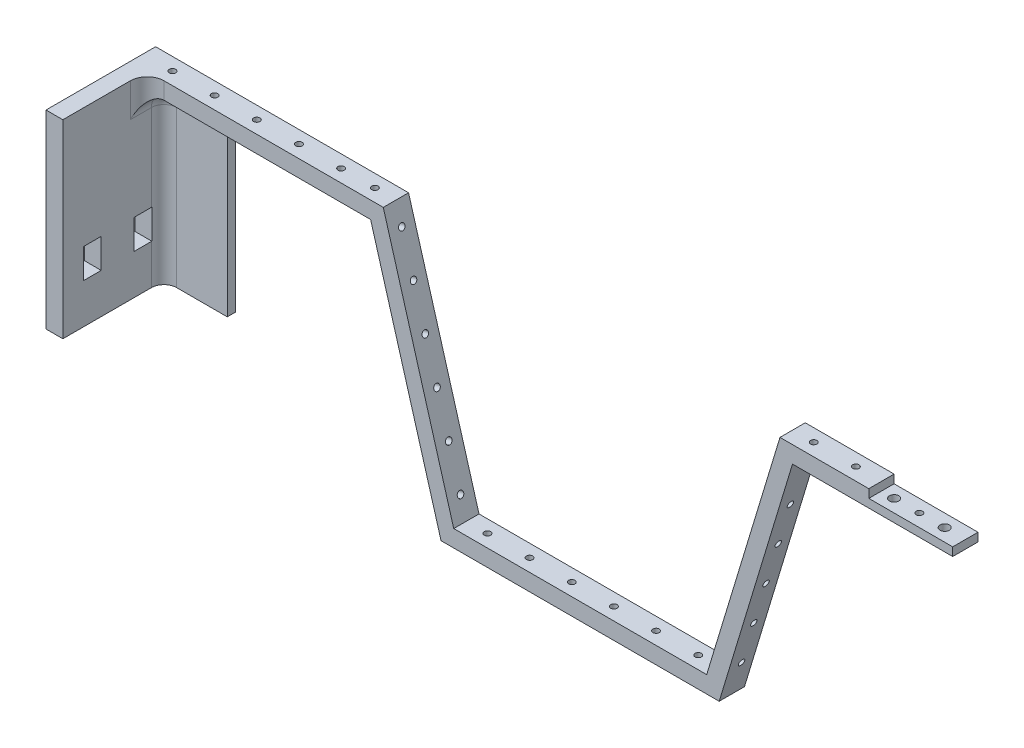
from build123d import *

# Parameters (mm, degrees)
BOSS_EXTRUDE1_DEPTH = 6
SKETCH2_R           = 1.1
CUT_EXTRUDE1_DEPTH  = 6
SKETCH3_R           = 0.75
CUT_EXTRUDE2_DEPTH  = 6
SKETCH4_R           = 0.75
CUT_EXTRUDE3_DEPTH  = 6
SKETCH5_R           = 0.75
CUT_EXTRUDE4_DEPTH  = 6
SKETCH6_R           = 0.75
CUT_EXTRUDE5_DEPTH  = 6
SKETCH7_R           = 0.75
CUT_EXTRUDE6_DEPTH  = 6
SKETCH8_R           = 0.75
CUT_EXTRUDE7_DEPTH  = 6
SKETCH9_R           = 0.75
CUT_EXTRUDE8_DEPTH  = 6
SKETCH12_W          = 20
SKETCH12_H          = 45
BOSS_EXTRUDE5_DEPTH = 4
FILLET4_R           = 4
SKETCH13_W          = 19
SKETCH13_H          = 45
BOSS_EXTRUDE6_DEPTH = 2
FILLET5_R           = 3
SKETCH14_W          = 4.2
SKETCH14_H          = 7
CUT_EXTRUDE10_DEPTH = 12


with BuildPart() as part:
    # Sketch1 → Boss-Extrude1 (new body)
    with BuildSketch(Plane.XY):
        Polygon((-23.705812739, 144.922992632), (-23.705812739, 142.922992632), (-61.705812739, 142.922992632), (-79.093908962, 85.497788151), (-145.066881196, 85.497788151), (-161.778348211, 143.123536478), (-214.773543294, 143.123536478), (-214.773543294, 102.123536478), (-218.773543294, 102.123536478), (-218.773543294, 147.123536478), (-158.773543294, 147.123536478), (-142.062076279, 89.497788151), (-82.062076279, 89.497788151), (-64.673980056, 146.922992632), (-43.605812739, 146.922992632), (-43.605812739, 144.922992632), align=None)
    extrude(amount=BOSS_EXTRUDE1_DEPTH)

    # Sketch2 → Cut-Extrude1 (cut)
    with BuildSketch(Plane(origin=(0, 144.922992632, 0), x_dir=(1, 0, 0), z_dir=(0, 1, 0))):
        with Locations(Location((-28.605812739, -3, 0), (0, 0, 270))):
            Circle(SKETCH2_R)
        with Locations(Location((-40.605812739, -3, 0), (0, 0, 270))):
            Circle(SKETCH2_R)
    extrude(amount=-CUT_EXTRUDE1_DEPTH, mode=Mode.SUBTRACT)

    # Sketch3 → Cut-Extrude2 (cut)
    with BuildSketch(Plane(origin=(0, 144.922992632, 0), x_dir=(1, 0, 0), z_dir=(0, 1, 0))):
        with Locations(Location((-34.605812739, -3, 0), (0, 0, 270))):
            Circle(SKETCH3_R)
    extrude(amount=-CUT_EXTRUDE2_DEPTH, mode=Mode.SUBTRACT)

    # Sketch4 → Cut-Extrude3 (cut)
    with BuildSketch(Plane(origin=(0, 146.922992632, 0), x_dir=(1, 0, 0), z_dir=(0, 1, 0))):
        with Locations(Location((-59.673980056, -3, 0), (0, 0, 270))):
            Circle(SKETCH4_R)
        with Locations(Location((-49.673980056, -3, 0), (0, 0, 270))):
            Circle(SKETCH4_R)
    extrude(amount=-CUT_EXTRUDE3_DEPTH, mode=Mode.SUBTRACT)

    # Sketch5 → Cut-Extrude4 (cut)
    with BuildSketch(Plane(origin=(-99.993673707, 30.277639163, 0), x_dir=(0, 0, 1), z_dir=(-0.957086741355951, 0.28980160372338726, 0))):
        with Locations(Location((3, 116.875425109, 0), (0, 0, 270))):
            Circle(SKETCH5_R)
        with Locations(Location((3, 106.875425109, 0), (0, 0, 270))):
            Circle(SKETCH5_R)
        with Locations(Location((3, 96.875425109, 0), (0, 0, 270))):
            Circle(SKETCH5_R)
        with Locations(Location((3, 86.875425109, 0), (0, 0, 270))):
            Circle(SKETCH5_R)
        with Locations(Location((3, 76.875425109, 0), (0, 0, 270))):
            Circle(SKETCH5_R)
        with Locations(Location((3, 66.875425109, 0), (0, 0, 270))):
            Circle(SKETCH5_R)
    extrude(amount=-CUT_EXTRUDE4_DEPTH, mode=Mode.SUBTRACT)

    # Sketch6 → Cut-Extrude5 (cut)
    with BuildSketch(Plane(origin=(0, 89.497788151, 0), x_dir=(1, 0, 0), z_dir=(0, 1, 0))):
        with Locations(Location((-87.062076279, -3, 0), (0, 0, 270))):
            Circle(SKETCH6_R)
        with Locations(Location((-97.062076279, -3, 0), (0, 0, 270))):
            Circle(SKETCH6_R)
        with Locations(Location((-107.062076279, -3, 0), (0, 0, 270))):
            Circle(SKETCH6_R)
        with Locations(Location((-117.062076279, -3, 0), (0, 0, 270))):
            Circle(SKETCH6_R)
        with Locations(Location((-127.062076279, -3, 0), (0, 0, 270))):
            Circle(SKETCH6_R)
        with Locations(Location((-137.062076279, -3, 0), (0, 0, 270))):
            Circle(SKETCH6_R)
    extrude(amount=-CUT_EXTRUDE5_DEPTH, mode=Mode.SUBTRACT)

    # Sketch7 → Cut-Extrude6 (cut)
    with BuildSketch(Plane(origin=(-107.100560571, -31.059162566, 0), x_dir=(0, 0, -1), z_dir=(0.960429138778729, 0.27852445024584294, 0))):
        with Locations(Location((-3, 180.524045293, 0), (0, 0, 90))):
            Circle(SKETCH7_R)
        with Locations(Location((-3, 170.524045293, 0), (0, 0, 90))):
            Circle(SKETCH7_R)
        with Locations(Location((-3, 160.524045293, 0), (0, 0, 90))):
            Circle(SKETCH7_R)
        with Locations(Location((-3, 150.524045293, 0), (0, 0, 90))):
            Circle(SKETCH7_R)
        with Locations(Location((-3, 140.524045293, 0), (0, 0, 90))):
            Circle(SKETCH7_R)
        with Locations(Location((-3, 130.524045293, 0), (0, 0, 90))):
            Circle(SKETCH7_R)
    extrude(amount=-CUT_EXTRUDE6_DEPTH, mode=Mode.SUBTRACT)

    # Sketch8 → Cut-Extrude7 (cut)
    with BuildSketch(Plane(origin=(0, 147.123536478, 0), x_dir=(1, 0, 0), z_dir=(0, 1, 0))):
        with Locations(Location((-211.773543294, -3, 0), (0, 0, 270))):
            Circle(SKETCH8_R)
        with Locations(Location((-201.773543294, -3, 0), (0, 0, 270))):
            Circle(SKETCH8_R)
        with Locations(Location((-191.773543294, -3, 0), (0, 0, 270))):
            Circle(SKETCH8_R)
        with Locations(Location((-181.773543294, -3, 0), (0, 0, 270))):
            Circle(SKETCH8_R)
        with Locations(Location((-171.773543294, -3, 0), (0, 0, 270))):
            Circle(SKETCH8_R)
    extrude(amount=-CUT_EXTRUDE7_DEPTH, mode=Mode.SUBTRACT)

    # Sketch9 → Cut-Extrude8 (cut)
    with BuildSketch(Plane(origin=(0, 147.123536478, 0), x_dir=(1, 0, 0), z_dir=(0, 1, 0))):
        with Locations(Location((-163.773543294, -3, 0), (0, 0, 270))):
            Circle(SKETCH9_R)
    extrude(amount=-CUT_EXTRUDE8_DEPTH, mode=Mode.SUBTRACT)

    # Sketch12 → Boss-Extrude5 (add)
    with BuildSketch(Plane.ZY.offset(218.773543294)):
        with Locations((16, 124.623536478)):
            Rectangle(SKETCH12_W, SKETCH12_H)
    extrude(amount=-BOSS_EXTRUDE5_DEPTH)

    # Fillet4
    # the kernel refuses this fillet: 4 mm, written as the material it adds along each edge
    with BuildSketch(Plane(origin=(-214.773543294, 143.123536478, 6), x_dir=(1, 0, 0), z_dir=(0, 1, 0))) as fillet4_piece_1:
        with BuildLine():
            CenterArc((FILLET4_R, -FILLET4_R), FILLET4_R, 90, 90)
            Line((0, -FILLET4_R), (0, 0))
            Line((0, 0), (FILLET4_R, 0))
        make_face()
    extrude(amount=4)
    with BuildSketch(Plane(origin=(-214.773543294, 143.123536478, 0), x_dir=(1, 0, 0), z_dir=(0, 0, 1))) as fillet4_piece_2_section:
        with BuildLine():
            CenterArc((FILLET4_R, -FILLET4_R), FILLET4_R, 90, 90)
            Line((0, -FILLET4_R), (0, 0))
            Line((0, 0), (FILLET4_R, 0))
        make_face()
    fillet4_piece_2 = extrude(amount=6, mode=Mode.PRIVATE)
    fillet4_piece_2 = fillet4_piece_2 - Plane(origin=(-211.773543294, 142.203820796, 3), x_dir=(0, 0, 1), z_dir=(0, 1, 0)) * Cylinder(0.75, 28, mode=Mode.PRIVATE)
    add(fillet4_piece_2)
    with BuildSketch(Plane(origin=(-214.773543294, 133.123536478, 6), x_dir=(1, 0, 0), z_dir=(0, 1, 0))) as fillet4_piece_3a_section:
        with BuildLine():
            CenterArc((FILLET4_R, -FILLET4_R), FILLET4_R, 90, 90)
            Line((0, -FILLET4_R), (0, 0))
            Line((0, 0), (FILLET4_R, 0))
        make_face()
    fillet4_piece_3a = extrude(amount=14, mode=Mode.PRIVATE)
    fillet4_piece_3a = split(fillet4_piece_3a, bisect_by=Plane(origin=(-213.867962837, 143.123536478, 6.905580457), z_dir=(0, -1, 0)), keep=Keep.TOP, mode=Mode.PRIVATE)
    with BuildSketch(Plane(origin=(-214.773543294, 143.123536478, 0), x_dir=(1, 0, 0), z_dir=(0, 0, 1))) as fillet4_piece_3b_section:
        with BuildLine():
            CenterArc((FILLET4_R, -FILLET4_R), FILLET4_R, 90, 90)
            Line((0, -FILLET4_R), (0, 0))
            Line((0, 0), (FILLET4_R, 0))
        make_face()
    fillet4_piece_3b = extrude(amount=16, mode=Mode.PRIVATE)
    fillet4_piece_3b = split(fillet4_piece_3b, bisect_by=Plane(origin=(-213.867962837, 142.217956021, 6), z_dir=(0, 0, 1)), keep=Keep.TOP, mode=Mode.PRIVATE)
    fillet4_piece_3 = fillet4_piece_3a & fillet4_piece_3b
    add(fillet4_piece_3)

    # Sketch13 → Boss-Extrude6 (add)
    with BuildSketch(Plane(origin=(0, 0, 0), x_dir=(-1, 0, 0), z_dir=(0, 0, -1))):
        with Locations((209.273543294, 124.623536478)):
            Rectangle(SKETCH13_W, SKETCH13_H)
    extrude(amount=-BOSS_EXTRUDE6_DEPTH)

    # Fillet5
    # the kernel refuses this fillet: 3 mm, written as the material it adds along each edge
    with BuildSketch(Plane(origin=(-210.773543294, 139.123536478, 2), x_dir=(-1, 0, 0), z_dir=(0, -1, 0))) as fillet5_piece_1_section:
        with BuildLine():
            CenterArc((4 - FILLET5_R, -FILLET5_R), FILLET5_R, 0, 90)
            Line((4, -FILLET5_R), (4, 0))
            Line((4, 0), (4 - FILLET5_R, 0))
        make_face()
    fillet5_piece_1 = revolve(axis=Axis((-210.773543294, 139.123536478, 2), (0, 0, -1)), revolution_arc=90, mode=Mode.PRIVATE)
    fillet5_piece_1 = fillet5_piece_1 - Plane(origin=(-211.773543294, 141.130848213, 3), x_dir=(0, 0, 1), z_dir=(0, 1, 0)) * Cylinder(0.75, 16, mode=Mode.PRIVATE)
    add(fillet5_piece_1)
    with BuildSketch(Plane(origin=(-199.773543294, 143.123536478, 0), x_dir=(0, -1, 0), z_dir=(0, 0, 1))) as fillet5_piece_2:
        with BuildLine():
            CenterArc((FILLET5_R, FILLET5_R), FILLET5_R, 180, 90)
            Line((0, FILLET5_R), (0, 0))
            Line((0, 0), (FILLET5_R, 0))
        make_face()
    extrude(amount=2)
    with BuildSketch(Plane(origin=(-214.773543294, 102.123536478, 2), x_dir=(0, 0, 1), z_dir=(0, 1, 0))) as fillet5_piece_3:
        with BuildLine():
            CenterArc((FILLET5_R, FILLET5_R), FILLET5_R, 180, 90)
            Line((0, FILLET5_R), (0, 0))
            Line((0, 0), (FILLET5_R, 0))
        make_face()
    extrude(amount=37)
    with BuildSketch(Plane(origin=(-210.773543294, 143.123536478, 2), x_dir=(0, 0, 1), z_dir=(1, 0, 0))) as fillet5_piece_4_section:
        with BuildLine():
            CenterArc((FILLET5_R, FILLET5_R), FILLET5_R, 180, 90)
            Line((0, FILLET5_R), (0, 0))
            Line((0, 0), (FILLET5_R, 0))
        make_face()
    fillet5_piece_4 = extrude(amount=11, mode=Mode.PRIVATE)
    fillet5_piece_4 = fillet5_piece_4 - Plane(origin=(-201.773543294, 142.429647528, 3), x_dir=(0, 0, 1), z_dir=(0, 1, 0)) * Cylinder(0.75, 35, mode=Mode.PRIVATE)
    add(fillet5_piece_4)
    with BuildSketch(Plane(origin=(-199.773543294, 143.123536478, 0), x_dir=(0, -1, 0), z_dir=(0, 0, 1))) as fillet5_piece_5a_section:
        with BuildLine():
            CenterArc((FILLET5_R, FILLET5_R), FILLET5_R, 180, 90)
            Line((0, FILLET5_R), (0, 0))
            Line((0, 0), (FILLET5_R, 0))
        make_face()
    fillet5_piece_5a = extrude(amount=9.5, mode=Mode.PRIVATE)
    fillet5_piece_5a = split(fillet5_piece_5a, bisect_by=Plane(origin=(-199.094357951, 142.444351135, 2), z_dir=(0, 0, 1)), keep=Keep.TOP, mode=Mode.PRIVATE)
    fillet5_piece_5a = split(fillet5_piece_5a, bisect_by=Plane(origin=(-199.094357951, 142.444351135, 6), z_dir=(0, 0, -1)), keep=Keep.TOP, mode=Mode.PRIVATE)
    with BuildSketch(Plane(origin=(-210.773543294, 143.123536478, 2), x_dir=(0, 0, 1), z_dir=(1, 0, 0))) as fillet5_piece_5b_section:
        with BuildLine():
            CenterArc((FILLET5_R, FILLET5_R), FILLET5_R, 180, 90)
            Line((0, FILLET5_R), (0, 0))
            Line((0, 0), (FILLET5_R, 0))
        make_face()
    fillet5_piece_5b = extrude(amount=18.5, mode=Mode.PRIVATE)
    fillet5_piece_5b = split(fillet5_piece_5b, bisect_by=Plane(origin=(-199.773543294, 142.441638418, 2.676766497), z_dir=(1, 0, 0)), keep=Keep.TOP, mode=Mode.PRIVATE)
    fillet5_piece_5b = fillet5_piece_5b - Plane(origin=(-191.773543294, 142.441638418, 3), x_dir=(0, 0, 1), z_dir=(0, 1, 0)) * Cylinder(0.75, 50, mode=Mode.PRIVATE)
    fillet5_piece_5 = fillet5_piece_5a & fillet5_piece_5b
    add(fillet5_piece_5)

    # Sketch14 → Cut-Extrude10 (cut)
    with BuildSketch(Plane.ZY.offset(218.773543294)):
        with Locations((7, 115.123536478)):
            Rectangle(SKETCH14_W, SKETCH14_H)
        with Locations((19, 115.123536478)):
            Rectangle(SKETCH14_W, SKETCH14_H)
    extrude(amount=-CUT_EXTRUDE10_DEPTH, mode=Mode.SUBTRACT)


solid = part.part
